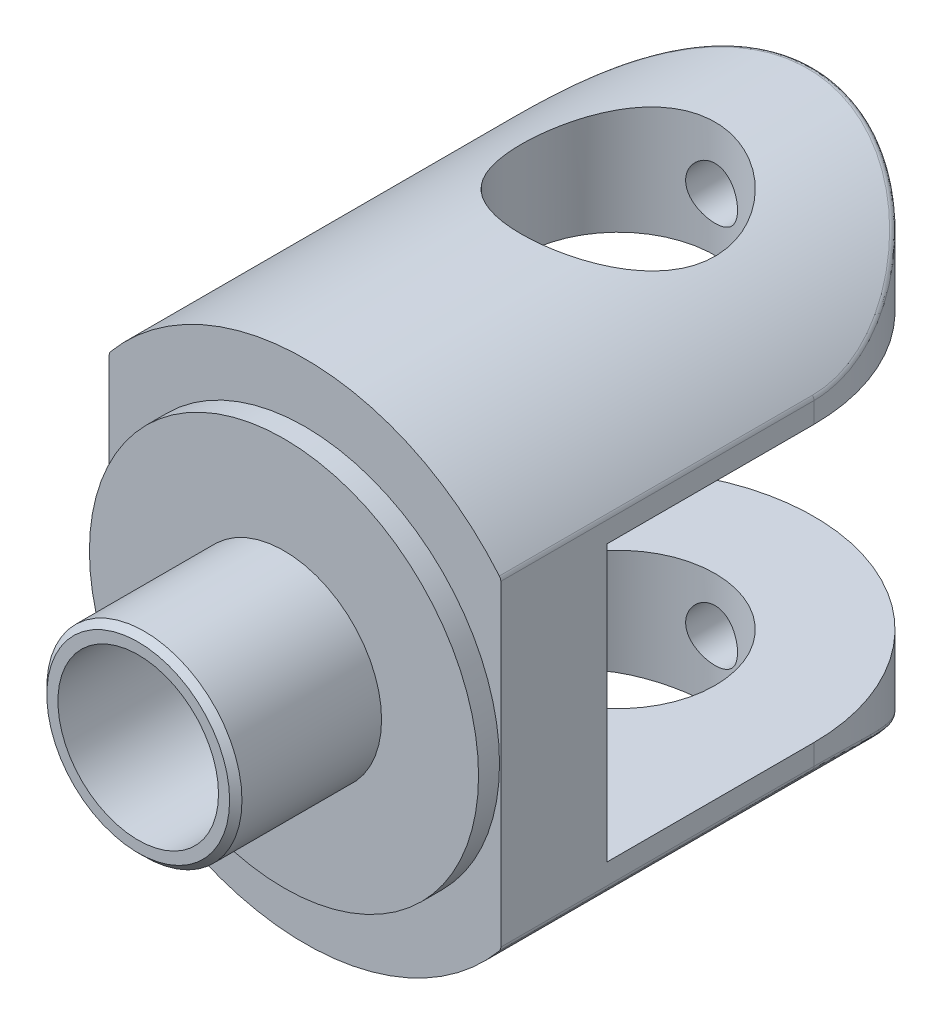
from build123d import *
from build123d.topology import SkipClean

# Parameters (mm, degrees)
SKETCH1_R               = 15.75
BOSS_EXTRUDE1_DEPTH     = 1.7
SKETCH2_R               = 7.9
BOSS_EXTRUDE2_DEPTH     = 11.8
SKETCH3_R               = 20.5
BOSS_EXTRUDE3_DEPTH     = 41.2
CUT_EXTRUDE1_START      = -41.2
CUT_EXTRUDE1_DEPTH      = 41.2
CUT_EXTRUDE2_DEPTH      = 20.6
SKETCH6_W               = 32.6
SKETCH6_H               = 22.3
CUT_EXTRUDE3_DEPTH      = 31.7
SKETCH7_R               = 7.85
CUT_EXTRUDE4_DEPTH      = 20.6
SKETCH9_R               = 6.5
CUT_EXTRUDE5_DEPTH      = 22.1
CHAMFER1_SIZE           = 0.5
FILLET1_R               = 0.5
CUT_EXTRUDE6_REACH      = 57.88
CUT_EXTRUDE6_END_RADIUS = 6.5
SKETCH10_R              = 2.5
THREAD1_PITCH           = 1
SKETCH13_R              = 6.5
CUT_EXTRUDE7_DEPTH      = 40.8
SKETCH14_R              = 2.1
CUT_EXTRUDE8_DEPTH      = 15


with BuildPart() as part:
    # Sketch1 → Boss-Extrude1 (new body)
    with BuildSketch(Plane.XY):
        Circle(SKETCH1_R)
    extrude(amount=BOSS_EXTRUDE1_DEPTH)

    # Sketch2 → Boss-Extrude2 (add)
    with BuildSketch(Plane.XY.offset(1.7)):
        Circle(SKETCH2_R)
    extrude(amount=BOSS_EXTRUDE2_DEPTH)

    # Sketch3 → Boss-Extrude3 (add)
    with BuildSketch(Plane(origin=(0, 0, 0), x_dir=(-1, 0, 0), z_dir=(0, 0, -1))):
        with Locations(Location((0, 0, 0), (0, 0, 180))):
            Circle(SKETCH3_R)
    extrude(amount=BOSS_EXTRUDE3_DEPTH)

    # Sketch4 → Cut-Extrude1 (cut)
    with BuildSketch(Plane(origin=(0, 0, -41.2), x_dir=(-1, 0, 0), z_dir=(0, 0, -1)).offset(CUT_EXTRUDE1_START)):
        with BuildLine():
            Line((-15.85, 13.001057649), (-15.85, -13.001057649))
            ThreePointArc((-15.85, -13.001057649), (-20.5, 0), (-15.85, 13.001057649))
        make_face()
        with BuildLine():
            Line((15.85, 13.001057649), (15.85, -13.001057649))
            ThreePointArc((15.85, -13.001057649), (20.5, 0), (15.85, 13.001057649))
        make_face()
    extrude(amount=CUT_EXTRUDE1_DEPTH, mode=Mode.SUBTRACT)

    # Sketch5 → Cut-Extrude2 (cut, symmetric)
    with BuildSketch(Plane(origin=(0, 0, 0), x_dir=(1, 0, 0), z_dir=(0, 1, 0))):
        with BuildLine():
            ThreePointArc((5.4e-08, 41.2), (11.207642501, 36.557642463), (15.85, 25.35))
            Line((15.85, 25.35), (15.85, 41.2))
            Line((15.85, 41.2), (5.4e-08, 41.2))
        make_face()
        with BuildLine():
            ThreePointArc((-15.85, 25.35), (-11.207642463, 36.557642501), (5.4e-08, 41.2))
            Line((5.4e-08, 41.2), (-15.85, 41.2))
            Line((-15.85, 41.2), (-15.85, 25.35))
        make_face()
    extrude(amount=CUT_EXTRUDE2_DEPTH, both=True, mode=Mode.SUBTRACT)

    # Sketch6 → Cut-Extrude3 (cut)
    with BuildSketch(Plane.ZY.offset(15.85)):
        with Locations((-24.9, 0)):
            Rectangle(SKETCH6_W, SKETCH6_H)
    extrude(amount=-CUT_EXTRUDE3_DEPTH, mode=Mode.SUBTRACT)

    # Sketch7 → Cut-Extrude4 (cut, symmetric)
    with BuildSketch(Plane(origin=(0, 0, 0), x_dir=(1, 0, 0), z_dir=(0, 1, 0))):
        with Locations(Location((0, 25.35, 0), (0, 0, 270))):
            Circle(SKETCH7_R)
    extrude(amount=CUT_EXTRUDE4_DEPTH, both=True, mode=Mode.SUBTRACT)

    # Sketch9 → Cut-Extrude5 (cut)
    with BuildSketch(Plane.XY.offset(13.5)):
        Circle(SKETCH9_R)
    extrude(amount=-CUT_EXTRUDE5_DEPTH, mode=Mode.SUBTRACT)

    # Chamfer1
    chamfer1_edges = [part.edges().sort_by_distance(p)[0] for p in [
        (-7.9, 0, 13.5),
    ]]
    chamfer(chamfer1_edges, length=CHAMFER1_SIZE)

    # Fillet1
    fillet1_edges = [part.edges().sort_by_distance(p)[0] for p in [
        (15.85, -13.001057649, -12.675),
        (15.85, 13.001057649, -12.675),
        (-15.85, 13.001057649, -12.675),
        (-15.85, -13.001057649, -12.675),
        (5.4e-08, -20.5, -41.2),
        (5.4e-08, 20.5, -41.2),
    ]]
    fillet(fillet1_edges, radius=FILLET1_R)

    # Cut-Extrude6: up to this cylinder (the profile starts outside it)
    cut_extrude6_end = Plane(origin=(0, 0, -4), z_dir=(0, 0, 1)) * Cylinder(CUT_EXTRUDE6_END_RADIUS, 129.76, mode=Mode.PRIVATE)
    # Sketch10 → Cut-Extrude6 (cut, up to the surface)
    with BuildSketch(Plane.ZY.offset(15.85), mode=Mode.PRIVATE) as cut_extrude6_sk1:
        with Locations((-4, 0)):
            Circle(SKETCH10_R)
    cut_extrude6_tool1 = extrude(cut_extrude6_sk1.sketch, amount=-CUT_EXTRUDE6_REACH, mode=Mode.PRIVATE) - cut_extrude6_end
    add(cut_extrude6_tool1.solids().sort_by_distance((-15.85, 0, -4))[0], mode=Mode.SUBTRACT)

    # Thread1: the profile of Thread Profile1 profile screwed along a right-hand helix of 10 turns, 8 arcs to a turn; built about Z, then put on its axis
    with SkipClean():  # the faces are left unmerged after this step: merging them gives an invalid solid
        thread1_z = Axis((0, 0, 0), (0, 0, 1))
        thread1_corners = [(2.5003, 0, -0.000173205), (2.5003, 0, 0.875173202), (1.958734125, 0, 0.562499999), (1.958734125, 0, 0.312499999)]
        with BuildLine(mode=Mode.PRIVATE) as thread1_profile:
            Line(thread1_corners[0], thread1_corners[1])
            Line(thread1_corners[1], thread1_corners[2])
            Line(thread1_corners[2], thread1_corners[3])
            Line(thread1_corners[3], thread1_corners[0])
        thread1_cap = Face(thread1_profile.wire())
        thread1_turn_angles = [0, 22.5, 45, 67.5, 90, 112.5, 135, 157.5, 180, 202.5, 225, 247.5, 270, 292.5, 315, 337.5, 360]
        thread1_turn_weights = [1, 0.9238795325112867, 1, 0.9238795325112867, 1, 0.9238795325112867, 1, 0.9238795325112867, 1, 0.9238795325112867, 1, 0.9238795325112867, 1, 0.9238795325112867, 1, 0.9238795325112867, 1]
        thread1_turn_rails = [Edge.make_bspline([Vector(p[0], p[1], 0).rotate(thread1_z, thread1_turn_angles[k]) / thread1_turn_weights[k] + Vector(0, 0, p[2] + THREAD1_PITCH * thread1_turn_angles[k] / 360) for k in range(17)], [0, 0, 0, 1, 1, 2, 2, 3, 3, 4, 4, 5, 5, 6, 6, 7, 7, 8, 8, 8], 2, thread1_turn_weights) for p in thread1_corners]
        thread1_turn_sides = [Face.make_surface_from_curves(thread1_turn_rails[p[0]], thread1_turn_rails[p[1]]) for p in [(0, 1), (1, 2), (2, 3), (3, 0)]]
        thread1 = Plane(origin=(-15.85, 0, -4), x_dir=(0, 0, -1), z_dir=(1, 0, 0)) * Solid(Shell([*[p.moved(Location((0, 0, THREAD1_PITCH * i))) for i in range(10) for p in thread1_turn_sides], thread1_cap, thread1_cap.rotate(thread1_z, 3600).moved(Location((0, 0, THREAD1_PITCH * 3600 / 360)))]))
        add(thread1)

    # Sketch13 → Cut-Extrude7 (cut)
    with SkipClean():  # the faces are left unmerged after this step: merging them gives an invalid solid
        with BuildSketch(Plane.XY.offset(13.5)):
            Circle(SKETCH13_R)
        extrude(amount=-CUT_EXTRUDE7_DEPTH, mode=Mode.SUBTRACT)

    # Sketch14 → Cut-Extrude8 (cut, symmetric)
    with SkipClean():  # the faces are left unmerged after this step: merging them gives an invalid solid
        with BuildSketch(Plane(origin=(0, 0, -40.6), x_dir=(-1, 0, 0), z_dir=(0, 0, -1))):
            with Locations(Location((0, 15.5, 0), (0, 0, 90))):
                Circle(SKETCH14_R)
            with Locations(Location((0, -15.5, 0), (0, 0, 90))):
                Circle(SKETCH14_R)
        extrude(amount=CUT_EXTRUDE8_DEPTH, both=True, mode=Mode.SUBTRACT)


solid = part.part
